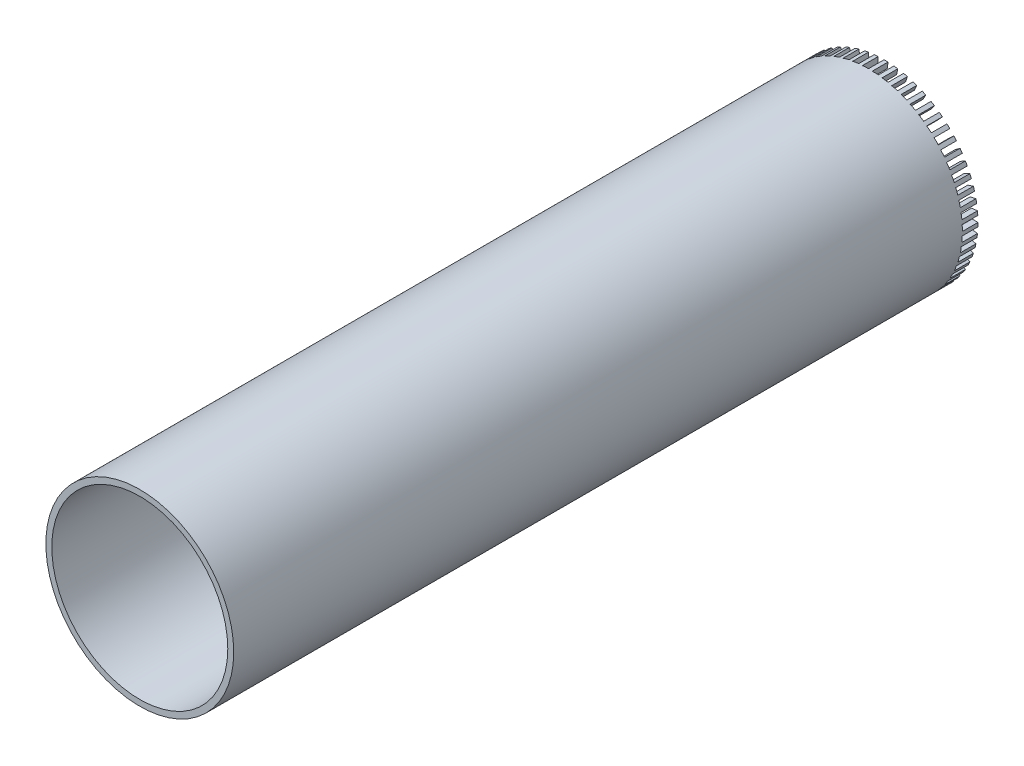
from build123d import *

# Parameters (mm, degrees)
SKETCH1_R           = 23.8535
SKETCH1_R_2         = 22.35
BOSS_EXTRUDE4_DEPTH = 189
CUT_EXTRUDE2_START  = -10
SKETCH5_W           = 1.5
SKETCH5_H           = 3.95
CUT_EXTRUDE2_DEPTH  = 202.986923837
CIRPATTERN1_COUNT   = 60
CUT_EXTRUDE3_DEPTH  = 1.5
CIRPATTERN6_COUNT   = 60


with BuildPart() as part:
    # Sketch1 → Boss-Extrude4 (new body)
    with BuildSketch(Plane.XY):
        Circle(SKETCH1_R)
        Circle(SKETCH1_R_2, mode=Mode.SUBTRACT)
    extrude(amount=BOSS_EXTRUDE4_DEPTH)

    # Sketch5 → Cut-Extrude2 (cut)
    with BuildSketch(Plane(origin=(0, 0, 0), x_dir=(1, 0, 0), z_dir=(0, 1, 0)).offset(CUT_EXTRUDE2_START)):
        with Locations((-0.75, -1.975)):
            Rectangle(SKETCH5_W, SKETCH5_H)
    cut_extrude2 = extrude(amount=CUT_EXTRUDE2_DEPTH, mode=Mode.SUBTRACT)

    # CirPattern1: Cut-Extrude2 ×60 about axis
    cirpattern1_axis = Axis((0, 0, 189), (0, 0, -1))
    for i in range(1, CIRPATTERN1_COUNT):
        add(cut_extrude2.rotate(cirpattern1_axis, i * 360 / CIRPATTERN1_COUNT), mode=Mode.SUBTRACT)

    # Sketch7 → Cut-Extrude3 (cut)
    with BuildSketch(Plane(origin=(0, 0, 0), x_dir=(0, 0, -1), z_dir=(1, 0, 0))):
        Polygon((-3.95, 23.8535), (-12.814094335, 16.420248369), (-1.537297756, 12.630493349), (0.329037716, 12.003280277), align=None)
    cut_extrude3 = extrude(amount=-CUT_EXTRUDE3_DEPTH, mode=Mode.SUBTRACT)

    # CirPattern6: Cut-Extrude3 ×60 about axis
    cirpattern6_axis = Axis((0, 0, 189), (0, 0, -1))
    for i in range(1, CIRPATTERN6_COUNT):
        add(cut_extrude3.rotate(cirpattern6_axis, i * 360 / CIRPATTERN6_COUNT), mode=Mode.SUBTRACT)


solid = part.part
